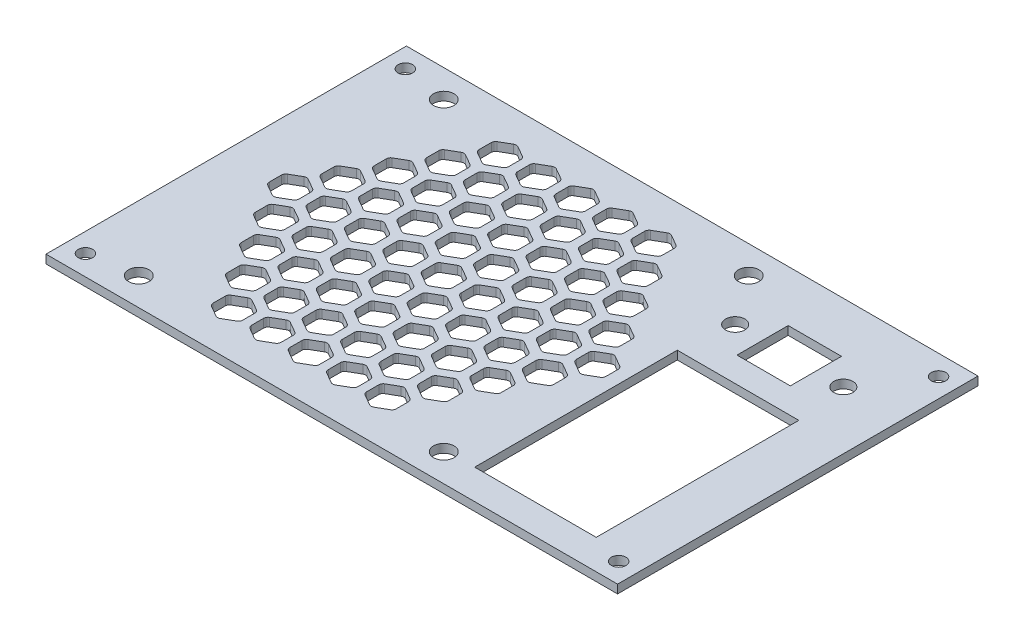
from build123d import *

# Parameters (mm, degrees)
SKETCH1_W                = 134
SKETCH1_H                = 84.5
BOSS_EXTRUDE1_DEPTH      = 2
M3_CLEARANCE_HOLE1_D     = 3.4
M3_CLEARANCE_HOLE1_DEPTH = 5
M3_CLEARANCE_HOLE1_TIP   = 1.021463052
M4_CLEARANCE_HOLE1_D     = 4.8
SKETCH9_W                = 28.5
SKETCH9_H                = 47.5
SKETCH9_W_2              = 12.5
SKETCH9_H_2              = 12
CUT_EXTRUDE1_DEPTH       = 159.430584169
M4_CLEARANCE_HOLE2_D     = 4.5
FILL_PATTERN1_DEPTH      = 2
FILLET2_R                = 1


with BuildPart() as part:
    # Sketch1 → Boss-Extrude1 (new body)
    with BuildSketch(Plane(origin=(0, 0, 0), x_dir=(1, 0, 0), z_dir=(0, 1, 0))):
        with Locations((67, 42.25)):
            Rectangle(SKETCH1_W, SKETCH1_H)
    extrude(amount=BOSS_EXTRUDE1_DEPTH)

    # M3 Clearance Hole1
    with Locations(Plane(origin=(0, 2, 0), x_dir=(1, 0, 0), z_dir=(0, 1, 0))):
        with Locations((4.5, 79.75), (129.5, 79.75), (129.5, 4.75), (4.5, 4.75)):
            Hole(M3_CLEARANCE_HOLE1_D / 2, depth=M3_CLEARANCE_HOLE1_DEPTH)
            with Locations((0, 0, -(M3_CLEARANCE_HOLE1_DEPTH + M3_CLEARANCE_HOLE1_TIP / 2))):  # 118° drill point
                Cone(0, M3_CLEARANCE_HOLE1_D / 2, M3_CLEARANCE_HOLE1_TIP, mode=Mode.SUBTRACT)

    # M4 Clearance Hole1 (through all)
    with Locations(Plane(origin=(0, 2, 0), x_dir=(1, 0, 0), z_dir=(0, 1, 0))):
        with Locations((15.25, 78), (86.75, 78), (86.75, 6.5), (15.25, 6.5)):
            Hole(M4_CLEARANCE_HOLE1_D / 2)

    # Sketch9 → Cut-Extrude1 (cut, through all)
    with BuildSketch(Plane(origin=(0, 2, 0), x_dir=(1, 0, 0), z_dir=(0, 1, 0))):
        with Locations((107.75, 30.75)):
            Rectangle(SKETCH9_W, SKETCH9_H)
        with Locations((107.75, 66.5)):
            Rectangle(SKETCH9_W_2, SKETCH9_H_2)
    extrude(amount=-CUT_EXTRUDE1_DEPTH, mode=Mode.SUBTRACT)

    # M4 Clearance Hole2 (through all)
    with Locations(Plane(origin=(0, 2, 0), x_dir=(1, 0, 0), z_dir=(0, 1, 0))):
        with Locations((95.075, 66.5), (120.425, 66.5)):
            Hole(M4_CLEARANCE_HOLE2_D / 2)

    # Fill Pattern1: read off the stored shape, not the designer's step
    # Fill Pattern1 outline → Fill Pattern1 (cut)
    with BuildSketch(Plane(origin=(0, 0, 0), x_dir=(1, 0, 0), z_dir=(0, 1, 0))):
        Polygon((83.535898385, 44.25), (83.535898385, 40.25), (87, 38.25), (90.464101615, 40.25), (90.464101615, 44.25), (87, 46.25), align=None)
        Polygon((70.035898385, 48.044228634), (73.5, 46.044228634), (76.964101615, 48.044228634), (76.964101615, 52.044228634), (73.5, 54.044228634), (70.035898385, 52.044228634), align=None)
        Polygon((56.535898385, 55.838457268), (60, 53.838457268), (63.464101615, 55.838457268), (63.464101615, 59.838457268), (60, 61.838457268), (56.535898385, 59.838457268), align=None)
        Polygon((43.035898385, 63.632685902), (46.5, 61.632685902), (49.964101615, 63.632685902), (49.964101615, 67.632685902), (46.5, 69.632685902), (43.035898385, 67.632685902), align=None)
        Polygon((29.535898385, 71.426914536), (33, 69.426914536), (36.464101615, 71.426914536), (36.464101615, 75.426914536), (33, 77.426914536), (29.535898385, 75.426914536), align=None)
        Polygon((33, 7.073085464), (36.464101615, 9.073085464), (36.464101615, 13.073085464), (33, 15.073085464), (29.535898385, 13.073085464), (29.535898385, 9.073085464), align=None)
        Polygon((73.5, 30.455771366), (76.964101615, 32.455771366), (76.964101615, 36.455771366), (73.5, 38.455771366), (70.035898385, 36.455771366), (70.035898385, 32.455771366), align=None)
        Polygon((60, 22.661542732), (63.464101615, 24.661542732), (63.464101615, 28.661542732), (60, 30.661542732), (56.535898385, 28.661542732), (56.535898385, 24.661542732), align=None)
        Polygon((46.5, 14.867314098), (49.964101615, 16.867314098), (49.964101615, 20.867314098), (46.5, 22.867314098), (43.035898385, 20.867314098), (43.035898385, 16.867314098), align=None)
        Polygon((70.035898385, 20.867314098), (70.035898385, 16.867314098), (73.5, 14.867314098), (76.964101615, 16.867314098), (76.964101615, 20.867314098), (73.5, 22.867314098), align=None)
        Polygon((70.035898385, 67.632685902), (70.035898385, 63.632685902), (73.5, 61.632685902), (76.964101615, 63.632685902), (76.964101615, 67.632685902), (73.5, 69.632685902), align=None)
        Polygon((43.035898385, 32.455771366), (46.5, 30.455771366), (49.964101615, 32.455771366), (49.964101615, 36.455771366), (46.5, 38.455771366), (43.035898385, 36.455771366), align=None)
        Polygon((29.535898385, 40.25), (33, 38.25), (36.464101615, 40.25), (36.464101615, 44.25), (33, 46.25), (29.535898385, 44.25), align=None)
        Polygon((16.035898385, 48.044228634), (19.5, 46.044228634), (22.964101615, 48.044228634), (22.964101615, 52.044228634), (19.5, 54.044228634), (16.035898385, 52.044228634), align=None)
        Polygon((60, 7.073085464), (63.464101615, 9.073085464), (63.464101615, 13.073085464), (60, 15.073085464), (56.535898385, 13.073085464), (56.535898385, 9.073085464), align=None)
        Polygon((65.535898385, 13.073085464), (65.535898385, 9.073085464), (69, 7.073085464), (72.464101615, 9.073085464), (72.464101615, 13.073085464), (69, 15.073085464), align=None)
        Polygon((65.535898385, 28.661542732), (65.535898385, 24.661542732), (69, 22.661542732), (72.464101615, 24.661542732), (72.464101615, 28.661542732), (69, 30.661542732), align=None)
        Polygon((65.535898385, 44.25), (65.535898385, 40.25), (69, 38.25), (72.464101615, 40.25), (72.464101615, 44.25), (69, 46.25), align=None)
        Polygon((65.535898385, 75.426914536), (65.535898385, 71.426914536), (69, 69.426914536), (72.464101615, 71.426914536), (72.464101615, 75.426914536), (69, 77.426914536), align=None)
        Polygon((65.535898385, 59.838457268), (65.535898385, 55.838457268), (69, 53.838457268), (72.464101615, 55.838457268), (72.464101615, 59.838457268), (69, 61.838457268), align=None)
        Polygon((52.035898385, 16.867314098), (55.5, 14.867314098), (58.964101615, 16.867314098), (58.964101615, 20.867314098), (55.5, 22.867314098), (52.035898385, 20.867314098), align=None)
        Polygon((38.535898385, 24.661542732), (42, 22.661542732), (45.464101615, 24.661542732), (45.464101615, 28.661542732), (42, 30.661542732), (38.535898385, 28.661542732), align=None)
        Polygon((25.035898385, 32.455771366), (28.5, 30.455771366), (31.964101615, 32.455771366), (31.964101615, 36.455771366), (28.5, 38.455771366), (25.035898385, 36.455771366), align=None)
        Polygon((11.535898385, 40.25), (15, 38.25), (18.464101615, 40.25), (18.464101615, 44.25), (15, 46.25), (11.535898385, 44.25), align=None)
        Polygon((56.535898385, 44.25), (56.535898385, 40.25), (60, 38.25), (63.464101615, 40.25), (63.464101615, 44.25), (60, 46.25), align=None)
        Polygon((56.535898385, 75.426914536), (56.535898385, 71.426914536), (60, 69.426914536), (63.464101615, 71.426914536), (63.464101615, 75.426914536), (60, 77.426914536), align=None)
        Polygon((29.535898385, 24.661542732), (33, 22.661542732), (36.464101615, 24.661542732), (36.464101615, 28.661542732), (33, 30.661542732), (29.535898385, 28.661542732), align=None)
        Polygon((16.035898385, 32.455771366), (19.5, 30.455771366), (22.964101615, 32.455771366), (22.964101615, 36.455771366), (19.5, 38.455771366), (16.035898385, 36.455771366), align=None)
        Polygon((29.535898385, 59.838457268), (29.535898385, 55.838457268), (33, 53.838457268), (36.464101615, 55.838457268), (36.464101615, 59.838457268), (33, 61.838457268), align=None)
        Polygon((79.035898385, 52.044228634), (79.035898385, 48.044228634), (82.5, 46.044228634), (85.964101615, 48.044228634), (85.964101615, 52.044228634), (82.5, 54.044228634), align=None)
        Polygon((79.035898385, 36.455771366), (79.035898385, 32.455771366), (82.5, 30.455771366), (85.964101615, 32.455771366), (85.964101615, 36.455771366), (82.5, 38.455771366), align=None)
        Polygon((52.035898385, 63.632685902), (55.5, 61.632685902), (58.964101615, 63.632685902), (58.964101615, 67.632685902), (55.5, 69.632685902), (52.035898385, 67.632685902), align=None)
        Polygon((38.535898385, 71.426914536), (42, 69.426914536), (45.464101615, 71.426914536), (45.464101615, 75.426914536), (42, 77.426914536), (38.535898385, 75.426914536), align=None)
        Polygon((28.5, 14.867314098), (31.964101615, 16.867314098), (31.964101615, 20.867314098), (28.5, 22.867314098), (25.035898385, 20.867314098), (25.035898385, 16.867314098), align=None)
        Polygon((55.5, 30.455771366), (58.964101615, 32.455771366), (58.964101615, 36.455771366), (55.5, 38.455771366), (52.035898385, 36.455771366), (52.035898385, 32.455771366), align=None)
        Polygon((52.035898385, 48.044228634), (55.5, 46.044228634), (58.964101615, 48.044228634), (58.964101615, 52.044228634), (55.5, 54.044228634), (52.035898385, 52.044228634), align=None)
        Polygon((38.535898385, 55.838457268), (42, 53.838457268), (45.464101615, 55.838457268), (45.464101615, 59.838457268), (42, 61.838457268), (38.535898385, 59.838457268), align=None)
        Polygon((25.035898385, 63.632685902), (28.5, 61.632685902), (31.964101615, 63.632685902), (31.964101615, 67.632685902), (28.5, 69.632685902), (25.035898385, 67.632685902), align=None)
        Polygon((42, 7.073085464), (45.464101615, 9.073085464), (45.464101615, 13.073085464), (42, 15.073085464), (38.535898385, 13.073085464), (38.535898385, 9.073085464), align=None)
        Polygon((74.535898385, 28.661542732), (74.535898385, 24.661542732), (78, 22.661542732), (81.464101615, 24.661542732), (81.464101615, 28.661542732), (78, 30.661542732), align=None)
        Polygon((74.535898385, 59.838457268), (74.535898385, 55.838457268), (78, 53.838457268), (81.464101615, 55.838457268), (81.464101615, 59.838457268), (78, 61.838457268), align=None)
        Polygon((74.535898385, 44.25), (74.535898385, 40.25), (78, 38.25), (81.464101615, 40.25), (81.464101615, 44.25), (78, 46.25), align=None)
        Polygon((61.035898385, 32.455771366), (64.5, 30.455771366), (67.964101615, 32.455771366), (67.964101615, 36.455771366), (64.5, 38.455771366), (61.035898385, 36.455771366), align=None)
        Polygon((47.535898385, 40.25), (51, 38.25), (54.464101615, 40.25), (54.464101615, 44.25), (51, 46.25), (47.535898385, 44.25), align=None)
        Polygon((34.035898385, 48.044228634), (37.5, 46.044228634), (40.964101615, 48.044228634), (40.964101615, 52.044228634), (37.5, 54.044228634), (34.035898385, 52.044228634), align=None)
        Polygon((20.535898385, 55.838457268), (24, 53.838457268), (27.464101615, 55.838457268), (27.464101615, 59.838457268), (24, 61.838457268), (20.535898385, 59.838457268), align=None)
        Polygon((64.5, 14.867314098), (67.964101615, 16.867314098), (67.964101615, 20.867314098), (64.5, 22.867314098), (61.035898385, 20.867314098), (61.035898385, 16.867314098), align=None)
        Polygon((51, 7.073085464), (54.464101615, 9.073085464), (54.464101615, 13.073085464), (51, 15.073085464), (47.535898385, 13.073085464), (47.535898385, 9.073085464), align=None)
        Polygon((38.535898385, 40.25), (42, 38.25), (45.464101615, 40.25), (45.464101615, 44.25), (42, 46.25), (38.535898385, 44.25), align=None)
        Polygon((25.035898385, 48.044228634), (28.5, 46.044228634), (31.964101615, 48.044228634), (31.964101615, 52.044228634), (28.5, 54.044228634), (25.035898385, 52.044228634), align=None)
        Polygon((61.035898385, 52.044228634), (61.035898385, 48.044228634), (64.5, 46.044228634), (67.964101615, 48.044228634), (67.964101615, 52.044228634), (64.5, 54.044228634), align=None)
        Polygon((61.035898385, 67.632685902), (61.035898385, 63.632685902), (64.5, 61.632685902), (67.964101615, 63.632685902), (67.964101615, 67.632685902), (64.5, 69.632685902), align=None)
        Polygon((47.535898385, 24.661542732), (51, 22.661542732), (54.464101615, 24.661542732), (54.464101615, 28.661542732), (51, 30.661542732), (47.535898385, 28.661542732), align=None)
        Polygon((34.035898385, 32.455771366), (37.5, 30.455771366), (40.964101615, 32.455771366), (40.964101615, 36.455771366), (37.5, 38.455771366), (34.035898385, 36.455771366), align=None)
        Polygon((20.535898385, 40.25), (24, 38.25), (27.464101615, 40.25), (27.464101615, 44.25), (24, 46.25), (20.535898385, 44.25), align=None)
        Polygon((47.535898385, 59.838457268), (47.535898385, 55.838457268), (51, 53.838457268), (54.464101615, 55.838457268), (54.464101615, 59.838457268), (51, 61.838457268), align=None)
        Polygon((47.535898385, 75.426914536), (47.535898385, 71.426914536), (51, 69.426914536), (54.464101615, 71.426914536), (54.464101615, 75.426914536), (51, 77.426914536), align=None)
        Polygon((34.035898385, 16.867314098), (37.5, 14.867314098), (40.964101615, 16.867314098), (40.964101615, 20.867314098), (37.5, 22.867314098), (34.035898385, 20.867314098), align=None)
        Polygon((20.535898385, 24.661542732), (24, 22.661542732), (27.464101615, 24.661542732), (27.464101615, 28.661542732), (24, 30.661542732), (20.535898385, 28.661542732), align=None)
        Polygon((34.035898385, 63.632685902), (37.5, 61.632685902), (40.964101615, 63.632685902), (40.964101615, 67.632685902), (37.5, 69.632685902), (34.035898385, 67.632685902), align=None)
        Polygon((43.035898385, 48.044228634), (46.5, 46.044228634), (49.964101615, 48.044228634), (49.964101615, 52.044228634), (46.5, 54.044228634), (43.035898385, 52.044228634), align=None)
    extrude(amount=FILL_PATTERN1_DEPTH, mode=Mode.SUBTRACT)

    # Fillet2
    fillet2_edges = [part.edges().sort_by_distance(p)[0] for p in [
        (38.535898385, 1, -71.426914536),
        (42, 1, -69.426914536),
        (45.464101615, 1, -71.426914536),
        (45.464101615, 1, -75.426914536),
        (42, 1, -77.426914536),
        (38.535898385, 1, -75.426914536),
        (34.035898385, 1, -63.632685902),
        (37.5, 1, -61.632685902),
        (40.964101615, 1, -63.632685902),
        (40.964101615, 1, -67.632685902),
        (37.5, 1, -69.632685902),
        (34.035898385, 1, -67.632685902),
        (25.035898385, 1, -63.632685902),
        (28.5, 1, -61.632685902),
        (31.964101615, 1, -63.632685902),
        (31.964101615, 1, -67.632685902),
        (28.5, 1, -69.632685902),
        (25.035898385, 1, -67.632685902),
        (20.535898385, 1, -55.838457268),
        (24, 1, -53.838457268),
        (27.464101615, 1, -55.838457268),
        (27.464101615, 1, -59.838457268),
        (24, 1, -61.838457268),
        (20.535898385, 1, -59.838457268),
        (83.535898385, 1, -40.25),
        (87, 1, -38.25),
        (29.535898385, 1, -71.426914536),
        (33, 1, -69.426914536),
        (36.464101615, 1, -71.426914536),
        (36.464101615, 1, -75.426914536),
        (33, 1, -77.426914536),
        (29.535898385, 1, -75.426914536),
        (90.464101615, 1, -40.25),
        (90.464101615, 1, -44.25),
        (87, 1, -46.25),
        (83.535898385, 1, -44.25),
        (70.035898385, 1, -16.867314098),
        (73.5, 1, -14.867314098),
        (76.964101615, 1, -16.867314098),
        (76.964101615, 1, -20.867314098),
        (73.5, 1, -22.867314098),
        (70.035898385, 1, -20.867314098),
        (65.535898385, 1, -9.073085464),
        (69, 1, -7.073085464),
        (72.464101615, 1, -9.073085464),
        (72.464101615, 1, -13.073085464),
        (69, 1, -15.073085464),
        (65.535898385, 1, -13.073085464),
        (56.535898385, 1, -9.073085464),
        (60, 1, -7.073085464),
        (63.464101615, 1, -9.073085464),
        (63.464101615, 1, -13.073085464),
        (60, 1, -15.073085464),
        (56.535898385, 1, -13.073085464),
        (29.535898385, 1, -9.073085464),
        (33, 1, -7.073085464),
        (36.464101615, 1, -9.073085464),
        (36.464101615, 1, -13.073085464),
        (33, 1, -15.073085464),
        (29.535898385, 1, -13.073085464),
        (79.035898385, 1, -48.044228634),
        (82.5, 1, -46.044228634),
        (85.964101615, 1, -48.044228634),
        (85.964101615, 1, -52.044228634),
        (82.5, 1, -54.044228634),
        (79.035898385, 1, -52.044228634),
        (79.035898385, 1, -32.455771366),
        (82.5, 1, -30.455771366),
        (85.964101615, 1, -32.455771366),
        (85.964101615, 1, -36.455771366),
        (82.5, 1, -38.455771366),
        (79.035898385, 1, -36.455771366),
        (74.535898385, 1, -24.661542732),
        (78, 1, -22.661542732),
        (81.464101615, 1, -24.661542732),
        (81.464101615, 1, -28.661542732),
        (78, 1, -30.661542732),
        (74.535898385, 1, -28.661542732),
        (65.535898385, 1, -24.661542732),
        (69, 1, -22.661542732),
        (72.464101615, 1, -24.661542732),
        (72.464101615, 1, -28.661542732),
        (69, 1, -30.661542732),
        (65.535898385, 1, -28.661542732),
        (61.035898385, 1, -16.867314098),
        (64.5, 1, -14.867314098),
        (67.964101615, 1, -16.867314098),
        (67.964101615, 1, -20.867314098),
        (64.5, 1, -22.867314098),
        (61.035898385, 1, -20.867314098),
        (52.035898385, 1, -16.867314098),
        (55.5, 1, -14.867314098),
        (58.964101615, 1, -16.867314098),
        (58.964101615, 1, -20.867314098),
        (55.5, 1, -22.867314098),
        (52.035898385, 1, -20.867314098),
        (47.535898385, 1, -9.073085464),
        (51, 1, -7.073085464),
        (54.464101615, 1, -9.073085464),
        (54.464101615, 1, -13.073085464),
        (51, 1, -15.073085464),
        (47.535898385, 1, -13.073085464),
        (38.535898385, 1, -9.073085464),
        (42, 1, -7.073085464),
        (45.464101615, 1, -9.073085464),
        (45.464101615, 1, -13.073085464),
        (42, 1, -15.073085464),
        (38.535898385, 1, -13.073085464),
        (25.035898385, 1, -16.867314098),
        (28.5, 1, -14.867314098),
        (31.964101615, 1, -16.867314098),
        (31.964101615, 1, -20.867314098),
        (28.5, 1, -22.867314098),
        (25.035898385, 1, -20.867314098),
        (74.535898385, 1, -55.838457268),
        (78, 1, -53.838457268),
        (81.464101615, 1, -55.838457268),
        (81.464101615, 1, -59.838457268),
        (78, 1, -61.838457268),
        (74.535898385, 1, -59.838457268),
        (74.535898385, 1, -40.25),
        (78, 1, -38.25),
        (81.464101615, 1, -40.25),
        (81.464101615, 1, -44.25),
        (78, 1, -46.25),
        (74.535898385, 1, -44.25),
        (70.035898385, 1, -32.455771366),
        (73.5, 1, -30.455771366),
        (76.964101615, 1, -32.455771366),
        (76.964101615, 1, -36.455771366),
        (73.5, 1, -38.455771366),
        (70.035898385, 1, -36.455771366),
        (61.035898385, 1, -32.455771366),
        (64.5, 1, -30.455771366),
        (67.964101615, 1, -32.455771366),
        (67.964101615, 1, -36.455771366),
        (64.5, 1, -38.455771366),
        (61.035898385, 1, -36.455771366),
        (56.535898385, 1, -24.661542732),
        (60, 1, -22.661542732),
        (63.464101615, 1, -24.661542732),
        (63.464101615, 1, -28.661542732),
        (60, 1, -30.661542732),
        (56.535898385, 1, -28.661542732),
        (47.535898385, 1, -24.661542732),
        (51, 1, -22.661542732),
        (54.464101615, 1, -24.661542732),
        (54.464101615, 1, -28.661542732),
        (51, 1, -30.661542732),
        (47.535898385, 1, -28.661542732),
        (43.035898385, 1, -16.867314098),
        (46.5, 1, -14.867314098),
        (49.964101615, 1, -16.867314098),
        (49.964101615, 1, -20.867314098),
        (46.5, 1, -22.867314098),
        (43.035898385, 1, -20.867314098),
        (34.035898385, 1, -16.867314098),
        (37.5, 1, -14.867314098),
        (40.964101615, 1, -16.867314098),
        (40.964101615, 1, -20.867314098),
        (37.5, 1, -22.867314098),
        (34.035898385, 1, -20.867314098),
        (20.535898385, 1, -24.661542732),
        (24, 1, -22.661542732),
        (27.464101615, 1, -24.661542732),
        (27.464101615, 1, -28.661542732),
        (24, 1, -30.661542732),
        (20.535898385, 1, -28.661542732),
        (70.035898385, 1, -63.632685902),
        (73.5, 1, -61.632685902),
        (76.964101615, 1, -63.632685902),
        (76.964101615, 1, -67.632685902),
        (73.5, 1, -69.632685902),
        (70.035898385, 1, -67.632685902),
        (70.035898385, 1, -48.044228634),
        (73.5, 1, -46.044228634),
        (76.964101615, 1, -48.044228634),
        (76.964101615, 1, -52.044228634),
        (73.5, 1, -54.044228634),
        (70.035898385, 1, -52.044228634),
        (65.535898385, 1, -40.25),
        (69, 1, -38.25),
        (72.464101615, 1, -40.25),
        (72.464101615, 1, -44.25),
        (69, 1, -46.25),
        (65.535898385, 1, -44.25),
        (56.535898385, 1, -40.25),
        (60, 1, -38.25),
        (63.464101615, 1, -40.25),
        (63.464101615, 1, -44.25),
        (60, 1, -46.25),
        (56.535898385, 1, -44.25),
        (52.035898385, 1, -32.455771366),
        (55.5, 1, -30.455771366),
        (58.964101615, 1, -32.455771366),
        (58.964101615, 1, -36.455771366),
        (55.5, 1, -38.455771366),
        (52.035898385, 1, -36.455771366),
        (43.035898385, 1, -32.455771366),
        (46.5, 1, -30.455771366),
        (49.964101615, 1, -32.455771366),
        (49.964101615, 1, -36.455771366),
        (46.5, 1, -38.455771366),
        (43.035898385, 1, -36.455771366),
        (38.535898385, 1, -24.661542732),
        (42, 1, -22.661542732),
        (45.464101615, 1, -24.661542732),
        (45.464101615, 1, -28.661542732),
        (42, 1, -30.661542732),
        (38.535898385, 1, -28.661542732),
        (29.535898385, 1, -24.661542732),
        (33, 1, -22.661542732),
        (36.464101615, 1, -24.661542732),
        (36.464101615, 1, -28.661542732),
        (33, 1, -30.661542732),
        (29.535898385, 1, -28.661542732),
        (16.035898385, 1, -32.455771366),
        (19.5, 1, -30.455771366),
        (22.964101615, 1, -32.455771366),
        (22.964101615, 1, -36.455771366),
        (19.5, 1, -38.455771366),
        (16.035898385, 1, -36.455771366),
        (65.535898385, 1, -71.426914536),
        (69, 1, -69.426914536),
        (72.464101615, 1, -71.426914536),
        (72.464101615, 1, -75.426914536),
        (69, 1, -77.426914536),
        (65.535898385, 1, -75.426914536),
        (65.535898385, 1, -55.838457268),
        (69, 1, -53.838457268),
        (72.464101615, 1, -55.838457268),
        (72.464101615, 1, -59.838457268),
        (69, 1, -61.838457268),
        (65.535898385, 1, -59.838457268),
        (61.035898385, 1, -48.044228634),
        (64.5, 1, -46.044228634),
        (67.964101615, 1, -48.044228634),
        (67.964101615, 1, -52.044228634),
        (64.5, 1, -54.044228634),
        (61.035898385, 1, -52.044228634),
        (52.035898385, 1, -48.044228634),
        (55.5, 1, -46.044228634),
        (58.964101615, 1, -48.044228634),
        (58.964101615, 1, -52.044228634),
        (55.5, 1, -54.044228634),
        (52.035898385, 1, -52.044228634),
        (47.535898385, 1, -40.25),
        (51, 1, -38.25),
        (54.464101615, 1, -40.25),
        (54.464101615, 1, -44.25),
        (51, 1, -46.25),
        (47.535898385, 1, -44.25),
        (38.535898385, 1, -40.25),
        (42, 1, -38.25),
        (45.464101615, 1, -40.25),
        (45.464101615, 1, -44.25),
        (42, 1, -46.25),
        (38.535898385, 1, -44.25),
        (34.035898385, 1, -32.455771366),
        (37.5, 1, -30.455771366),
        (40.964101615, 1, -32.455771366),
        (40.964101615, 1, -36.455771366),
        (37.5, 1, -38.455771366),
        (34.035898385, 1, -36.455771366),
        (25.035898385, 1, -32.455771366),
        (28.5, 1, -30.455771366),
        (31.964101615, 1, -32.455771366),
        (31.964101615, 1, -36.455771366),
        (28.5, 1, -38.455771366),
        (25.035898385, 1, -36.455771366),
        (11.535898385, 1, -40.25),
        (15, 1, -38.25),
        (18.464101615, 1, -40.25),
        (18.464101615, 1, -44.25),
        (15, 1, -46.25),
        (11.535898385, 1, -44.25),
        (61.035898385, 1, -63.632685902),
        (64.5, 1, -61.632685902),
        (67.964101615, 1, -63.632685902),
        (67.964101615, 1, -67.632685902),
        (64.5, 1, -69.632685902),
        (61.035898385, 1, -67.632685902),
        (56.535898385, 1, -55.838457268),
        (60, 1, -53.838457268),
        (63.464101615, 1, -55.838457268),
        (63.464101615, 1, -59.838457268),
        (60, 1, -61.838457268),
        (56.535898385, 1, -59.838457268),
        (47.535898385, 1, -55.838457268),
        (51, 1, -53.838457268),
        (54.464101615, 1, -55.838457268),
        (54.464101615, 1, -59.838457268),
        (51, 1, -61.838457268),
        (47.535898385, 1, -59.838457268),
        (43.035898385, 1, -48.044228634),
        (46.5, 1, -46.044228634),
        (49.964101615, 1, -48.044228634),
        (49.964101615, 1, -52.044228634),
        (46.5, 1, -54.044228634),
        (43.035898385, 1, -52.044228634),
        (34.035898385, 1, -48.044228634),
        (37.5, 1, -46.044228634),
        (40.964101615, 1, -48.044228634),
        (40.964101615, 1, -52.044228634),
        (37.5, 1, -54.044228634),
        (34.035898385, 1, -52.044228634),
        (29.535898385, 1, -40.25),
        (33, 1, -38.25),
        (36.464101615, 1, -40.25),
        (36.464101615, 1, -44.25),
        (33, 1, -46.25),
        (29.535898385, 1, -44.25),
        (20.535898385, 1, -40.25),
        (24, 1, -38.25),
        (27.464101615, 1, -40.25),
        (27.464101615, 1, -44.25),
        (24, 1, -46.25),
        (20.535898385, 1, -44.25),
        (56.535898385, 1, -71.426914536),
        (60, 1, -69.426914536),
        (63.464101615, 1, -71.426914536),
        (63.464101615, 1, -75.426914536),
        (60, 1, -77.426914536),
        (56.535898385, 1, -75.426914536),
        (52.035898385, 1, -63.632685902),
        (55.5, 1, -61.632685902),
        (58.964101615, 1, -63.632685902),
        (58.964101615, 1, -67.632685902),
        (55.5, 1, -69.632685902),
        (52.035898385, 1, -67.632685902),
        (43.035898385, 1, -63.632685902),
        (46.5, 1, -61.632685902),
        (49.964101615, 1, -63.632685902),
        (49.964101615, 1, -67.632685902),
        (46.5, 1, -69.632685902),
        (43.035898385, 1, -67.632685902),
        (38.535898385, 1, -55.838457268),
        (42, 1, -53.838457268),
        (45.464101615, 1, -55.838457268),
        (45.464101615, 1, -59.838457268),
        (42, 1, -61.838457268),
        (38.535898385, 1, -59.838457268),
        (29.535898385, 1, -55.838457268),
        (33, 1, -53.838457268),
        (36.464101615, 1, -55.838457268),
        (36.464101615, 1, -59.838457268),
        (33, 1, -61.838457268),
        (29.535898385, 1, -59.838457268),
        (25.035898385, 1, -48.044228634),
        (28.5, 1, -46.044228634),
        (31.964101615, 1, -48.044228634),
        (31.964101615, 1, -52.044228634),
        (28.5, 1, -54.044228634),
        (25.035898385, 1, -52.044228634),
        (16.035898385, 1, -48.044228634),
        (19.5, 1, -46.044228634),
        (22.964101615, 1, -48.044228634),
        (22.964101615, 1, -52.044228634),
        (19.5, 1, -54.044228634),
        (16.035898385, 1, -52.044228634),
        (47.535898385, 1, -71.426914536),
        (51, 1, -69.426914536),
        (54.464101615, 1, -71.426914536),
        (54.464101615, 1, -75.426914536),
        (51, 1, -77.426914536),
        (47.535898385, 1, -75.426914536),
    ]]
    fillet(fillet2_edges, radius=FILLET2_R)


solid = part.part
